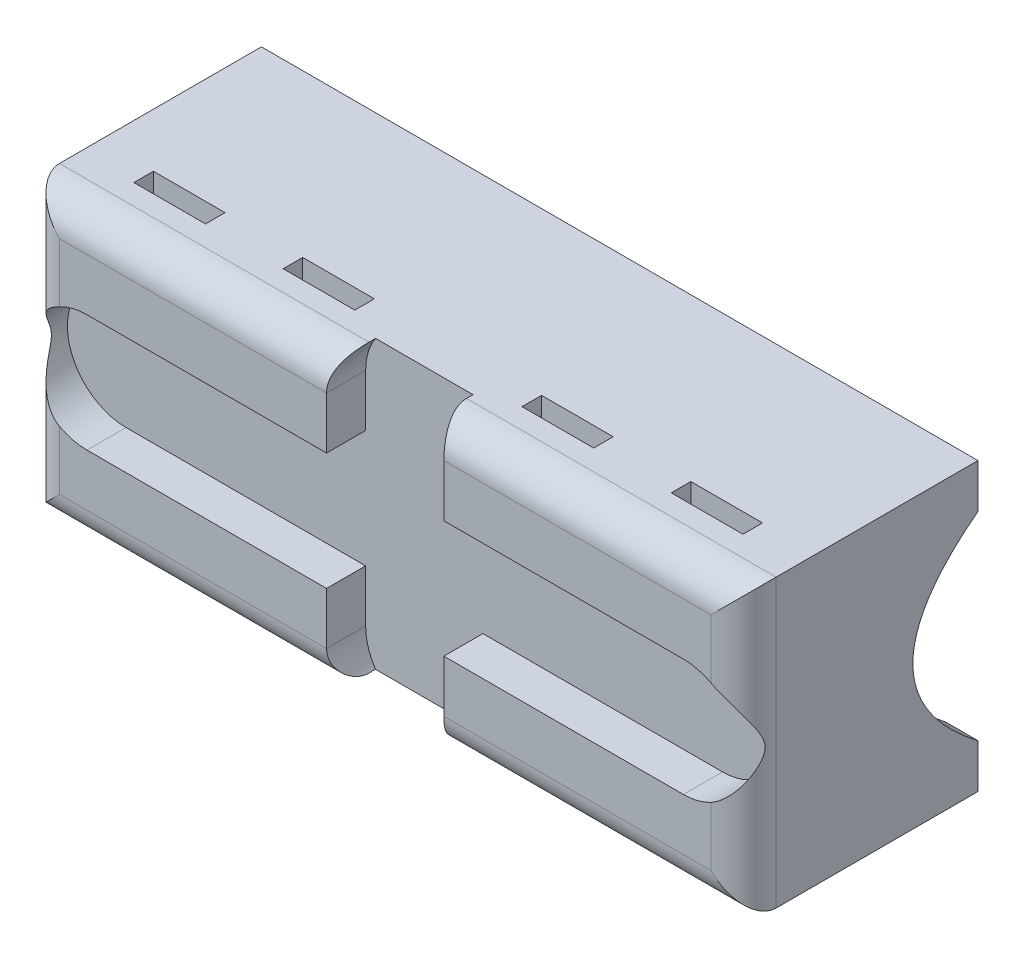
from build123d import *

# Parameters (mm, degrees)
SKETCH1_W           = 55
SKETCH1_H           = 22
BOSS_EXTRUDE1_DEPTH = 18
CUT_EXTRUDE2_START  = -55
CUT_EXTRUDE2_DEPTH  = 55
SKETCH5_W           = 50
SKETCH5_H           = 17
CUT_EXTRUDE3_DEPTH  = 10
FILLET1_R           = 2.5
CUT_EXTRUDE4_DEPTH  = 3
SKETCH8_W           = 5.5
SKETCH8_H           = 1.5
CUT_EXTRUDE5_DEPTH  = 32


# Read off the part's stored shape, not the designer's step: Cut-Extrude2
with BuildPart() as part:
    # Sketch1 → Boss-Extrude1 (new body)
    with BuildSketch(Plane.XY):
        with Locations((-16.417297699, 9.516109874)):
            Rectangle(SKETCH1_W, SKETCH1_H)
    extrude(amount=BOSS_EXTRUDE1_DEPTH)

    # Cut-Extrude2 outline → Cut-Extrude2 (cut)
    with BuildSketch(Plane(origin=(11.082702301, 0, 0), x_dir=(0, 0, -1), z_dir=(1, 0, 0)).offset(CUT_EXTRUDE2_START)):
        with BuildLine():
            add(Edge.make_bspline(
                [(0, 1.8942341), (-9.999457611, 9.516109874), (0, 17.137985647)],
                knots=[0, 0, 0, 1, 1, 1], degree=2))
            Line((0, 1.8942341), (0, 17.137985647))
        make_face()
    extrude(amount=CUT_EXTRUDE2_DEPTH, mode=Mode.SUBTRACT)

    # Sketch5 → Cut-Extrude3 (cut)
    with BuildSketch(Plane(origin=(0, 0, 0), x_dir=(-1, 0, 0), z_dir=(0, 0, -1))):
        with Locations((16.417297699, 9.516109874)):
            Rectangle(SKETCH5_W, SKETCH5_H)
    extrude(amount=-CUT_EXTRUDE3_DEPTH, mode=Mode.SUBTRACT)

    # Fillet1
    fillet1_edges = [part.edges().sort_by_distance(p)[0] for p in [
        (11.082702301, 9.516109874, 18),
        (-16.417297699, 20.516109874, 18),
        (-43.917297699, 9.516109874, 18),
        (-16.417297699, -1.483890126, 18),
    ]]
    fillet(fillet1_edges, radius=FILLET1_R)

    # Sketch7 → Cut-Extrude4 (cut)
    with BuildSketch(Plane.XY.offset(18)):
        with BuildLine():
            Line((-39.308664902, 14.016109874), (-20.917297699, 14.016109874))
            Line((-20.917297699, 14.016109874), (-20.917297699, 18.016109874))
            ThreePointArc((-20.917297699, 18.016109874), (-16.417297699, 22.516109874), (-11.917297699, 18.016109874))
            Line((-11.917297699, 18.016109874), (-11.917297699, 14.016109874))
            Line((-11.917297699, 14.016109874), (6.474069505, 14.016109874))
            ThreePointArc((6.474069505, 14.016109874), (10.974069505, 9.516109874), (6.474069505, 5.016109874))
            Line((6.474069505, 5.016109874), (-11.917297699, 5.016109874))
            Line((-11.917297699, 5.016109874), (-11.917297699, 1.016109874))
            ThreePointArc((-11.917297699, 1.016109874), (-16.417297699, -3.483890126), (-20.917297699, 1.016109874))
            Line((-20.917297699, 1.016109874), (-20.917297699, 5.016109874))
            Line((-20.917297699, 5.016109874), (-39.308664902, 5.016109874))
            ThreePointArc((-39.308664902, 5.016109874), (-43.808664902, 9.516109874), (-39.308664902, 14.016109874))
        make_face()
    extrude(amount=-CUT_EXTRUDE4_DEPTH, mode=Mode.SUBTRACT)

    # Sketch8 → Cut-Extrude5 (cut)
    with BuildSketch(Plane(origin=(0, 20.516109874, 0), x_dir=(1, 0, 0), z_dir=(0, 1, 0))):
        with Locations((-37.042297699, -13.165280764)):
            Rectangle(SKETCH8_W, SKETCH8_H)
        with Locations((-7.250631032, -13.165280764)):
            Rectangle(SKETCH8_W, SKETCH8_H)
        with Locations((4.207702301, -13.165280764)):
            Rectangle(SKETCH8_W, SKETCH8_H)
        with Locations((-25.583964365, -13.165280764)):
            Rectangle(SKETCH8_W, SKETCH8_H)
    extrude(amount=-CUT_EXTRUDE5_DEPTH, mode=Mode.SUBTRACT)


solid = part.part
